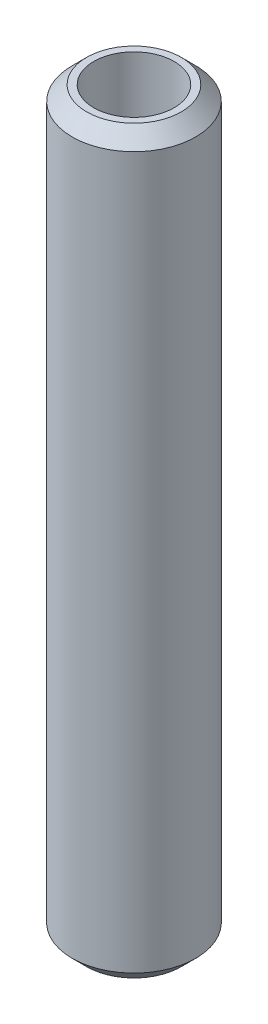
from build123d import *

# Parameters (mm, degrees)
SKETCH1_R           = 7.5
BOSS_EXTRUDE1_DEPTH = 89.905274098
SKETCH2_R           = 4.879104787
CUT_EXTRUDE1_DEPTH  = 91.528770623
CHAMFER1_SIZE       = 1.757394383


with BuildPart() as part:
    # Sketch1 → Boss-Extrude1 (new body)
    with BuildSketch(Plane(origin=(0, 0, 0), x_dir=(1, 0, 0), z_dir=(0, 1, 0))):
        Circle(SKETCH1_R)
    extrude(amount=BOSS_EXTRUDE1_DEPTH)

    # Sketch2 → Cut-Extrude1 (cut, through all)
    with BuildSketch(Plane(origin=(0, 0, 0), x_dir=(1, 0, 0), z_dir=(0, 1, 0))):
        Circle(SKETCH2_R)
    extrude(amount=CUT_EXTRUDE1_DEPTH, mode=Mode.SUBTRACT)

    # Chamfer1
    chamfer1_edges = [part.edges().sort_by_distance(p)[0] for p in [
        (-7.5, 89.905274098, 0),
        (-7.5, 0, 0),
    ]]
    chamfer(chamfer1_edges, length=CHAMFER1_SIZE)


solid = part.part
